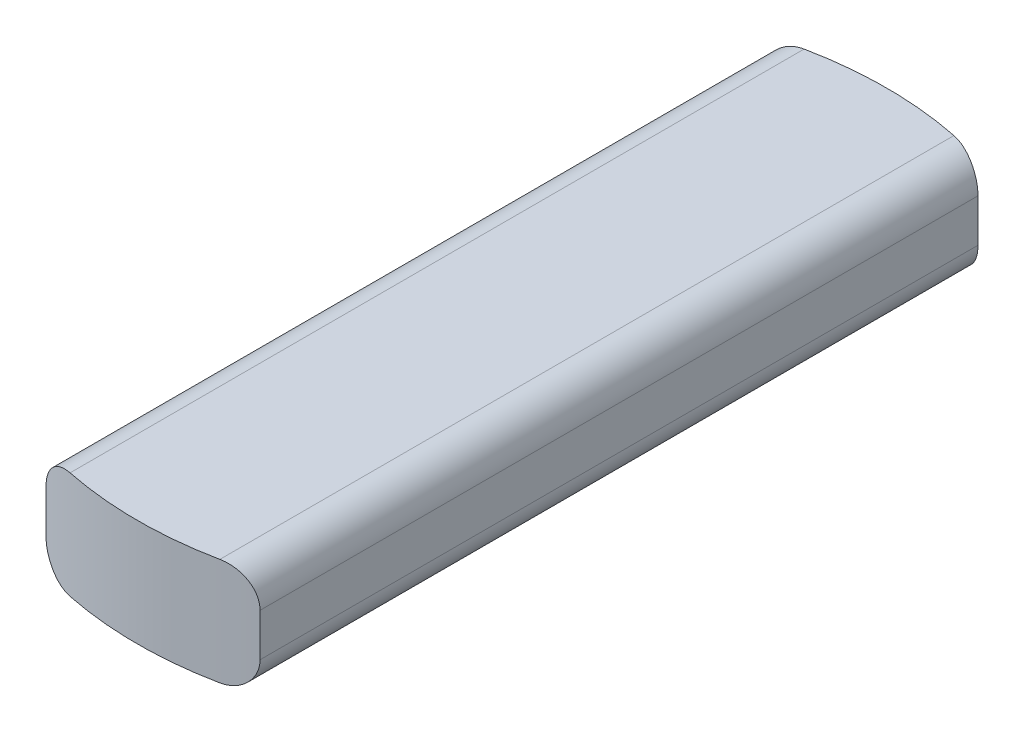
from build123d import *

# Parameters (mm, degrees)
BOSS_EXTRUDE1_DEPTH = 17.5
CUT_EXTRUDE1_START  = -2.5
CUT_EXTRUDE1_DEPTH  = 5


# Read off the part's stored shape, not the designer's step: Cut-Extrude1
with BuildPart() as part:
    # Sketch1 → Boss-Extrude1 (new, symmetric)
    with BuildSketch(Plane.XY):
        with BuildLine():
            Line((-3.5, -2.5), (3.5, -2.5))
            ThreePointArc((3.5, -2.5), (4.560660172, -2.060660172), (5, -1))
            Line((5, -1), (5, 1))
            ThreePointArc((5, 1), (4.560660172, 2.060660172), (3.5, 2.5))
            Line((3.5, 2.5), (-3.5, 2.5))
            ThreePointArc((-3.5, 2.5), (-4.560660172, 2.060660172), (-5, 1))
            Line((-5, 1), (-5, -1))
            ThreePointArc((-5, -1), (-4.560660172, -2.060660172), (-3.5, -2.5))
        make_face()
    extrude(amount=BOSS_EXTRUDE1_DEPTH, both=True)

    # Cut-Extrude1 outline → Cut-Extrude1 (cut)
    with BuildSketch(Plane(origin=(0, 0, 0), x_dir=(1, 0, 0), z_dir=(0, 1, 0)).offset(CUT_EXTRUDE1_START)):
        with BuildLine():
            ThreePointArc((-1.03e-07, -17.5), (-2.52646852, -17.316667024), (-5.000001513, -16.77050938))
            Line((-5.000001513, -16.77050938), (-5, -17.5))
            Line((-5, -17.5), (-1.03e-07, -17.5))
        make_face()
        with BuildLine():
            ThreePointArc((5.000001513, -16.77050938), (2.526468418, -17.316667039), (-1.03e-07, -17.5))
            Line((-1.03e-07, -17.5), (5, -17.5))
            Line((5, -17.5), (5.000001513, -16.77050938))
        make_face()
        with BuildLine():
            Line((-5, 17.5), (-5.000001513, 16.77050938))
            ThreePointArc((-5.000001513, 16.77050938), (-2.526468418, 17.316667039), (1.03e-07, 17.5))
            Line((1.03e-07, 17.5), (-5, 17.5))
        make_face()
        with BuildLine():
            Line((5, 17.5), (1.03e-07, 17.5))
            ThreePointArc((1.03e-07, 17.5), (2.52646852, 17.316667024), (5.000001513, 16.77050938))
            Line((5.000001513, 16.77050938), (5, 17.5))
        make_face()
    extrude(amount=CUT_EXTRUDE1_DEPTH, mode=Mode.SUBTRACT)


solid = part.part
